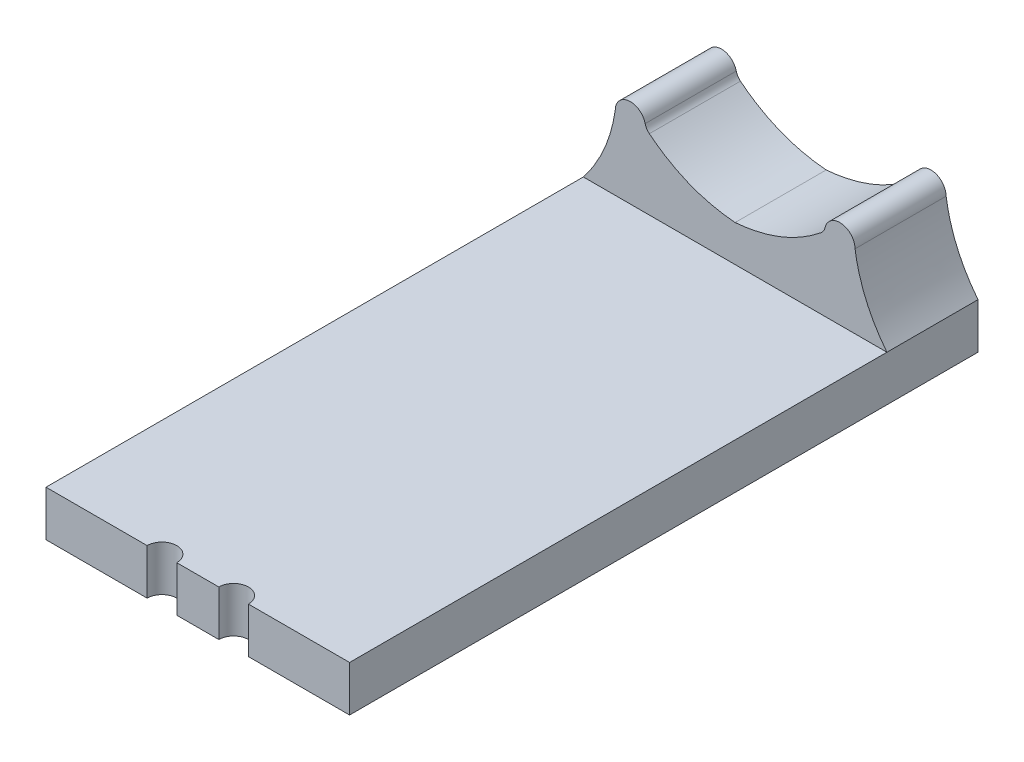
from build123d import *

# Parameters (mm, degrees)
BOSS_EXTRUDE1_DEPTH = 9.525
SKETCH2_W           = 63.5
SKETCH2_H           = 9.525
BOSS_EXTRUDE2_DEPTH = 121.92
FILLET2_R           = 2.54
SKETCH3_R           = 3.1
CUT_EXTRUDE1_DEPTH  = 128.347545756


with BuildPart() as part:
    # Sketch1 → Boss-Extrude1 (new, symmetric)
    with BuildSketch(Plane.XY):
        with BuildLine():
            Line((-31.75, -53.34), (-31.75, -62.865))
            Line((-31.75, -62.865), (31.75, -62.865))
            Line((31.75, -62.865), (31.75, -53.34))
            add(Edge.make_bspline(
                [(25.0825, -37.944903067), (26.340260763, -46.478514272), (31.75, -53.34)],
                knots=[0, 0, 0, 1, 1, 1], degree=2))
            ThreePointArc((25.0825, -37.944903067), (21.9075, -34.769903067), (18.7325, -37.944903067))
            add(Edge.make_bspline(
                [(18.7325, -37.944903067), (10.633340365, -44.866866243), (0, -45.72)],
                knots=[0, 0, 0, 1, 1, 1], degree=2))
            add(Edge.make_bspline(
                [(-18.7325, -37.944903067), (-10.633340365, -44.866866243), (0, -45.72)],
                knots=[0, 0, 0, 1, 1, 1], degree=2))
            ThreePointArc((-18.7325, -37.944903067), (-21.9075, -34.769903067), (-25.0825, -37.944903067))
            add(Edge.make_bspline(
                [(-25.0825, -37.944903067), (-26.340260763, -46.478514272), (-31.75, -53.34)],
                knots=[0, 0, 0, 1, 1, 1], degree=2))
        make_face()
    extrude(amount=BOSS_EXTRUDE1_DEPTH, both=True)

    # Sketch2 → Boss-Extrude2 (add)
    with BuildSketch(Plane.XY):
        with Locations((0, -58.1025)):
            Rectangle(SKETCH2_W, SKETCH2_H)
    extrude(amount=BOSS_EXTRUDE2_DEPTH)

    # Fillet2
    fillet2_edges = [part.edges().sort_by_distance(p)[0] for p in [
        (18.7325, -37.944903067, 4.7625),
        (-18.7325, -37.944903067, -4.7625),
    ]]
    fillet(fillet2_edges, radius=FILLET2_R)

    # Sketch3 → Cut-Extrude1 (cut, through all)
    with BuildSketch(Plane(origin=(0, -53.34, 0), x_dir=(1, 0, 0), z_dir=(0, 1, 0))):
        with Locations((7.5, -121.92)):
            Circle(SKETCH3_R)
        with Locations((-7.5, -121.92)):
            Circle(SKETCH3_R)
    extrude(amount=-CUT_EXTRUDE1_DEPTH, mode=Mode.SUBTRACT)


solid = part.part
